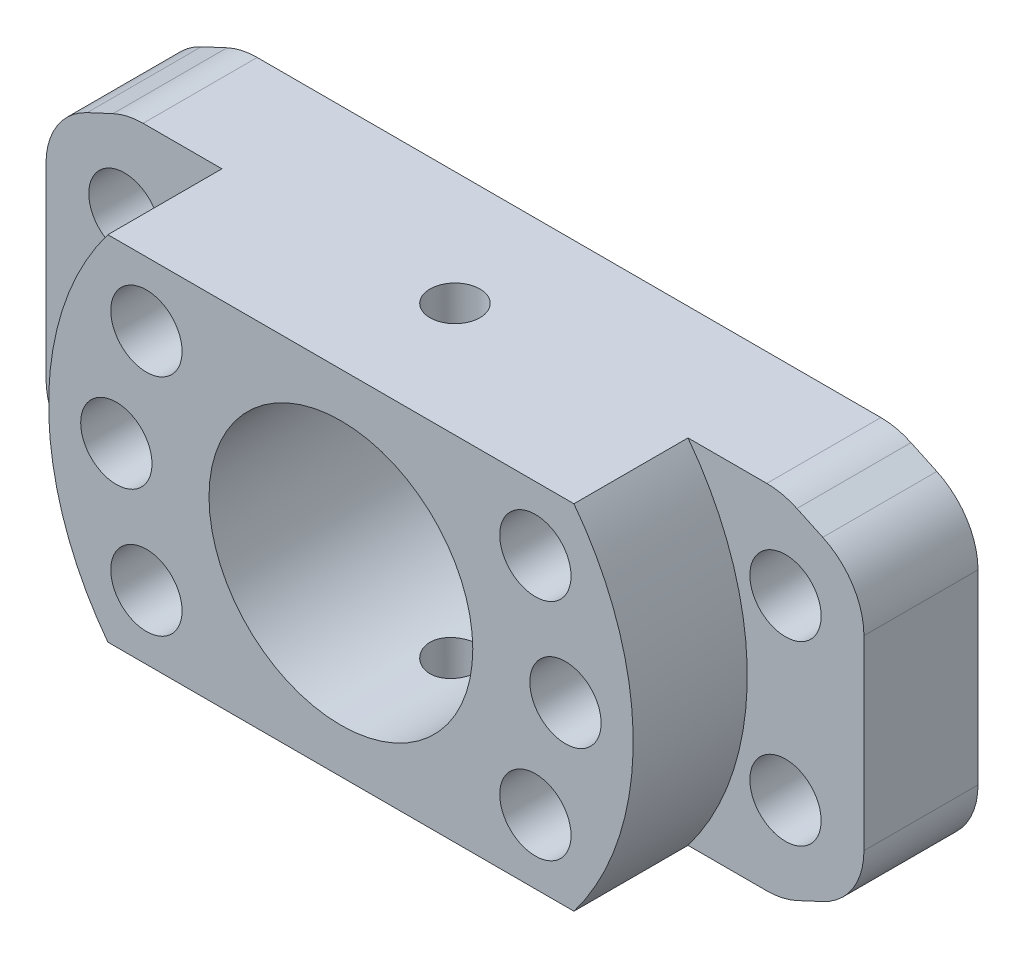
from build123d import *

# Parameters (mm, degrees)
SKETCH_1_R          = 9.25
SKETCH_1_R_2        = 2.5
EXTRUDE_1_DEPTH     = 8
SKETCH_2_R          = 2.5
SKETCH_2_R_2        = 9.25
EXTRUDE_2_DEPTH     = 8
FILLET_1_R          = 5
SKETCH_3_R          = 1.75
CUT_EXTRUDE_1_DEPTH = 42.124594034


with BuildPart() as part:
    # ｽｹｯﾁ1 → ﾎﾞｽ - 押し出し1 (new body)
    with BuildSketch(Plane.XY):
        Polygon((-22.978996998, 12.375), (22.978996998, 12.375), (28.682219831, 9.715543517), (28.682219831, -9.715543517), (22.978996998, -12.375), (-22.978996998, -12.375), (-28.682219831, -9.715543517), (-28.682219831, 9.715543517), align=None)
        Circle(SKETCH_1_R, mode=Mode.SUBTRACT)
        with Locations((13.63990011, 7.875)):
            Circle(SKETCH_1_R_2, mode=Mode.SUBTRACT)
        with Locations((15.75, 0)):
            Circle(SKETCH_1_R_2, mode=Mode.SUBTRACT)
        with Locations((23.182219831, 6.211657082)):
            Circle(SKETCH_1_R_2, mode=Mode.SUBTRACT)
        with Locations((13.63990011, -7.875)):
            Circle(SKETCH_1_R_2, mode=Mode.SUBTRACT)
        with Locations((23.182219831, -6.211657082)):
            Circle(SKETCH_1_R_2, mode=Mode.SUBTRACT)
        with Locations((-13.63990011, -7.875)):
            Circle(SKETCH_1_R_2, mode=Mode.SUBTRACT)
        with Locations((-23.182219831, -6.211657082)):
            Circle(SKETCH_1_R_2, mode=Mode.SUBTRACT)
        with Locations((-15.75, 0)):
            Circle(SKETCH_1_R_2, mode=Mode.SUBTRACT)
        with Locations((-23.182219831, 6.211657082)):
            Circle(SKETCH_1_R_2, mode=Mode.SUBTRACT)
        with Locations((-13.63990011, 7.875)):
            Circle(SKETCH_1_R_2, mode=Mode.SUBTRACT)
    extrude(amount=EXTRUDE_1_DEPTH)

    # ｽｹｯﾁ2 → ﾎﾞｽ - 押し出し2 (add)
    with BuildSketch(Plane.XY.offset(8)):
        with BuildLine():
            Line((-16.343481116, 12.375), (16.343481116, 12.375))
            ThreePointArc((16.343481116, 12.375), (20.5, 0), (16.343481116, -12.375))
            Line((16.343481116, -12.375), (-16.343481116, -12.375))
            ThreePointArc((-16.343481116, -12.375), (-20.5, 0), (-16.343481116, 12.375))
        make_face()
        with Locations((13.63990011, -7.875)):
            Circle(SKETCH_2_R, mode=Mode.SUBTRACT)
        with Locations((15.75, 0)):
            Circle(SKETCH_2_R, mode=Mode.SUBTRACT)
        with Locations((13.63990011, 7.875)):
            Circle(SKETCH_2_R, mode=Mode.SUBTRACT)
        Circle(SKETCH_2_R_2, mode=Mode.SUBTRACT)
        with Locations((-13.63990011, 7.875)):
            Circle(SKETCH_2_R, mode=Mode.SUBTRACT)
        with Locations((-15.75, 0)):
            Circle(SKETCH_2_R, mode=Mode.SUBTRACT)
        with Locations((-13.63990011, -7.875)):
            Circle(SKETCH_2_R, mode=Mode.SUBTRACT)
    extrude(amount=EXTRUDE_2_DEPTH)

    # ﾌｨﾚｯﾄ1
    fillet_1_edges = [part.edges().sort_by_distance(p)[0] for p in [
        (22.978996998, 12.375, 4),
        (28.682219831, 9.715543517, 4),
        (22.978996998, -12.375, 4),
        (28.682219831, -9.715543517, 4),
        (-22.978996998, -12.375, 4),
        (-28.682219831, -9.715543517, 4),
        (-28.682219831, 9.715543517, 4),
        (-22.978996998, 12.375, 4),
    ]]
    fillet(fillet_1_edges, radius=FILLET_1_R)

    # ｽｹｯﾁ3 → ｶｯﾄ - 押し出し1 (cut, through all)
    with BuildSketch(Plane.XZ.offset(12.375)):
        with Locations((0, 8)):
            Circle(SKETCH_3_R)
    extrude(amount=-CUT_EXTRUDE_1_DEPTH, mode=Mode.SUBTRACT)


solid = part.part
